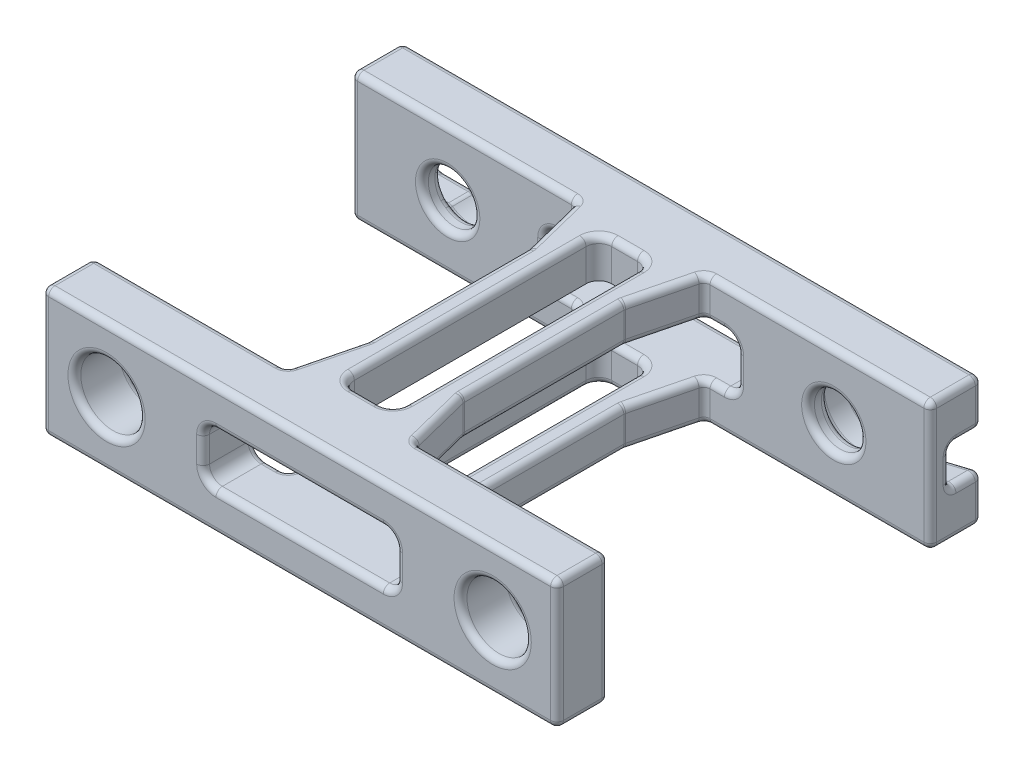
from build123d import *

# Parameters (mm, degrees)
SKETCH1_W               = 30
SKETCH1_H               = 20
SKETCH1_R               = 2
BOSS_EXTRUDE1_DEPTH     = 8
SKETCH2_R               = 2
CUT_EXTRUDE1_DEPTH      = 5
BOSS_EXTRUDE2_DEPTH     = 20
CUT_EXTRUDE2_DEPTH      = 20
CUT_EXTRUDE2_DEPTH_BACK = 62.717096497
SKETCH4_R               = 5
SKETCH5_R               = 4
SKETCH5_R_2             = 2
CUT_EXTRUDE3_DEPTH      = 65.311740763
FILLET4_R               = 1
FILLET5_R               = 1
SKETCH7_W               = 8
SKETCH7_H               = 24.753788748
CUT_EXTRUDE4_DEPTH      = 99.721831522
FILLET6_R               = 1
CUT_EXTRUDE5_DEPTH      = 98.190534669
CUT_EXTRUDE5_DEPTH_BACK = 98.190534669
FILLET7_R               = 1


with BuildPart() as part:
    # Sketch1 → Boss-Extrude1 (new body)
    with BuildSketch(Plane.XY):
        Rectangle(SKETCH1_W, SKETCH1_H)
        Circle(SKETCH1_R, mode=Mode.SUBTRACT)
    extrude(amount=BOSS_EXTRUDE1_DEPTH)

    # Sketch2 → Cut-Extrude1 (cut)
    with BuildSketch(Plane(origin=(0, 0, 0), x_dir=(-1, 0, 0), z_dir=(0, 0, -1))):
        with BuildLine():
            Line((-3.491060011, 4.25), (-8.491060011, 4.25))
            Line((-8.491060011, 4.25), (-15, 2.666622158))
            Line((-15, 2.666622158), (-15, -2.666622158))
            Line((-15, -2.666622158), (-8.491060011, -4.25))
            Line((-8.491060011, -4.25), (-3.491060011, -4.25))
            ThreePointArc((-3.491060011, -4.25), (5.5, 0), (-3.491060011, 4.25))
        make_face()
        Circle(SKETCH2_R, mode=Mode.SUBTRACT)
    extrude(amount=-CUT_EXTRUDE1_DEPTH, mode=Mode.SUBTRACT)

    # Sketch5 → Cut-Extrude3 (cut, through all)
    with BuildSketch(Plane(origin=(0, 0, 5), x_dir=(-1, 0, 0), z_dir=(0, 0, -1))):
        Circle(SKETCH5_R)
        Circle(SKETCH5_R_2, mode=Mode.SUBTRACT)
    extrude(amount=-CUT_EXTRUDE3_DEPTH, mode=Mode.SUBTRACT)


with BuildPart() as body_2:
    # Sketch3 → Boss-Extrude2 (new body)
    with BuildSketch(Plane(origin=(0, 10, 0), x_dir=(1, 0, 0), z_dir=(0, 1, 0))):
        Polygon((-30, -61), (10, -61), (10, -53), (-20, -53), (-22.5, -43), (-22.5, -18), (-20, -8), (-15, -8), (-15, 0), (-30, 0), align=None)
    extrude(amount=-BOSS_EXTRUDE2_DEPTH)

    # Sketch4 → Cut-Extrude2 (cut, two sides: drawn at the far end of the back side and taken through both)
    with BuildSketch(Plane(origin=(0, 0, 53), x_dir=(-1, 0, 0), z_dir=(0, 0, -1)).offset(-CUT_EXTRUDE2_DEPTH_BACK)):
        Circle(SKETCH4_R)
    extrude(amount=CUT_EXTRUDE2_DEPTH + CUT_EXTRUDE2_DEPTH_BACK, mode=Mode.SUBTRACT)


with BuildPart() as body_3:
    # Mirror4: mirrored copy
    add(body_2.part.mirror(Plane(origin=(-30, -10, 0), x_dir=(0, 0, 1), z_dir=(-1, 0, 0))))


with BuildPart() as body_4:
    # Mirror4 2: mirrored copy
    add(part.part.mirror(Plane(origin=(-30, -10, 0), x_dir=(0, 0, 1), z_dir=(-1, 0, 0))))


with BuildPart() as body_3_1:
    add(body_3.part)

    # Combine1: union body 2, body 4, part
    add(body_2.part)
    add(body_4.part)
    add(part.part)

    # Fillet4
    fillet4_edges = [body_3_1.edges().sort_by_distance(p)[0] for p in [
        (-37.5, -10, 30.5),
        (-55, 10, 53),
        (-70, 10, 57),
        (-30, 10, 61),
        (-30, 10, 0),
        (-38.75, -10, 13),
        (-57.5, 10, 8),
        (-38.75, 10, 13),
        (-37.5, 10, 30.5),
        (-38.75, 10, 48),
        (-57.5, -10, 8),
        (-40, 0, 53),
        (-70, 0, 53),
        (-70, 0, 61),
        (-40, 0, 8),
        (-37.5, 0, 18),
        (-37.5, 0, 43),
        (-30, -10, 0),
        (-30, -10, 61),
        (-38.75, -10, 48),
        (-70, -10, 57),
        (-55, -10, 53),
        (-21.25, 10, 48),
        (-22.5, 0, 43),
        (-5, 10, 53),
        (-20, 0, 53),
        (10, 10, 57),
        (10, 0, 53),
        (10, 0, 61),
        (11.745530005, 3.458311079, 0),
        (5.991060011, -4.25, 0),
        (-2.5, 10, 8),
        (15, 0, 8),
        (-21.25, -10, 13),
        (-20, 0, 8),
        (-22.5, -10, 30.5),
        (-22.5, 0, 18),
        (-21.25, -10, 48),
        (-5, -10, 53),
        (10, -10, 57),
        (-2.5, -10, 8),
        (-22.5, 10, 30.5),
        (-21.25, 10, 13),
        (15, 10, 4),
        (15, -6.333311079, 0),
        (15, 2.666622158, 2.5),
        (15, 6.333311079, 0),
        (15, -10, 4),
        (5.991060011, -4.25, 5),
        (8.491060011, -4.25, 2.5),
        (11.745530005, -3.458311079, 0),
        (15, -2.666622158, 2.5),
        (11.745530005, 3.458311079, 5),
        (8.491060011, 4.25, 2.5),
        (5.991060011, 4.25, 0),
        (3.491060011, 4.25, 2.5),
        (-5.5, 0, 0),
        (3.491060011, -4.25, 2.5),
        (-5.5, 0, 5),
        (5.991060011, 4.25, 5),
        (15, 0, 5),
        (11.745530005, -3.458311079, 5),
        (4, 0, 8),
        (-54.5, 0, 0),
        (-65.991060011, 4.25, 0),
        (-75, 6.333311079, 0),
        (-75, -6.333311079, 0),
        (-71.745530005, -3.458311079, 0),
        (-75, 0, 8),
        (-75, 10, 4),
        (-75, 0, 5),
        (-75, -2.666622158, 2.5),
        (-75, -10, 4),
        (-65.991060011, -4.25, 0),
        (-63.491060011, -4.25, 2.5),
        (-71.745530005, -3.458311079, 5),
        (-68.491060011, -4.25, 2.5),
        (-71.745530005, 3.458311079, 0),
        (-75, 2.666622158, 2.5),
        (-65.991060011, 4.25, 5),
        (-68.491060011, 4.25, 2.5),
        (-54.5, 0, 5),
        (-63.491060011, 4.25, 2.5),
        (-65.991060011, -4.25, 5),
        (-71.745530005, 3.458311079, 5),
    ]]
    fillet(fillet4_edges, radius=FILLET4_R)

    # Fillet5
    fillet5_edges = [body_3_1.edges().sort_by_distance(p)[0] for p in [
        (-4.5, 0, 5),
        (-55.5, 0, 5),
        (-65, 0, 61),
        (-65, 0, 53),
        (5, 0, 53),
        (5, 0, 61),
        (4, 0, 5),
        (-64, 0, 8),
        (-64, 0, 5),
    ]]
    fillet(fillet5_edges, radius=FILLET5_R)

    # Sketch7 → Cut-Extrude4 (cut, through all)
    with BuildSketch(Plane.XZ.offset(10)):
        with BuildLine():
            Line((-26, 12.5), (-26, 18.123105626))
            Line((-26, 18.123105626), (-34, 18.123105626))
            Line((-34, 18.123105626), (-34, 12.5))
            ThreePointArc((-34, 12.5), (-33.414213562, 11.085786438), (-32, 10.5))
            Line((-32, 10.5), (-28, 10.5))
            ThreePointArc((-28, 10.5), (-26.585786438, 11.085786438), (-26, 12.5))
        make_face()
        with Locations((-30, 30.5)):
            Rectangle(SKETCH7_W, SKETCH7_H)
        with BuildLine():
            Line((-34, 42.876894374), (-26, 42.876894374))
            Line((-26, 42.876894374), (-26, 48.5))
            ThreePointArc((-26, 48.5), (-26.585786438, 49.914213562), (-28, 50.5))
            Line((-28, 50.5), (-32, 50.5))
            ThreePointArc((-32, 50.5), (-33.414213562, 49.914213562), (-34, 48.5))
            Line((-34, 48.5), (-34, 42.876894374))
        make_face()
    extrude(amount=-CUT_EXTRUDE4_DEPTH, mode=Mode.SUBTRACT)

    # Fillet6
    fillet6_edges = [body_3_1.edges().sort_by_distance(p)[0] for p in [
        (-26.585786438, -10, 11.085786438),
        (-30, -10, 10.5),
        (-33.414213562, 10, 11.085786438),
        (-34, -10, 30.5),
        (-33.414213562, 10, 49.914213562),
        (-30, 10, 50.5),
        (-26.585786438, -10, 49.914213562),
        (-26, 10, 30.5),
        (-26.585786438, 10, 11.085786438),
        (-30, 10, 10.5),
        (-34, 10, 30.5),
        (-26.585786438, 10, 49.914213562),
        (-26, -10, 30.5),
        (-30, -10, 50.5),
        (-33.414213562, -10, 49.914213562),
        (-33.414213562, -10, 11.085786438),
    ]]
    fillet(fillet6_edges, radius=FILLET6_R)

    # Sketch8 → Cut-Extrude5 (cut, two sides: drawn at the far end of the back side and taken through both)
    with BuildSketch(Plane.XY.offset(61).offset(-CUT_EXTRUDE5_DEPTH_BACK)):
        with BuildLine():
            Line((-43, -4), (-17, -4))
            ThreePointArc((-17, -4), (-15.585786438, -3.414213562), (-15, -2))
            Line((-15, -2), (-15, 2))
            ThreePointArc((-15, 2), (-15.585786438, 3.414213562), (-17, 4))
            Line((-17, 4), (-43, 4))
            ThreePointArc((-43, 4), (-44.414213562, 3.414213562), (-45, 2))
            Line((-45, 2), (-45, -2))
            ThreePointArc((-45, -2), (-44.414213562, -3.414213562), (-43, -4))
        make_face()
    extrude(amount=CUT_EXTRUDE5_DEPTH + CUT_EXTRUDE5_DEPTH_BACK, mode=Mode.SUBTRACT)

    # Fillet7
    fillet7_edges = [body_3_1.edges().sort_by_distance(p)[0] for p in [
        (-26, -4, 30.5),
        (-15.585786438, -3.414213562, 8),
        (-15, 0, 8),
        (-15.585786438, 3.414213562, 8),
        (-44.414213562, -3.414213562, 8),
        (-45, 0, 8),
        (-44.414213562, 3.414213562, 8),
        (-44.414213562, -3.414213562, 61),
        (-45, 0, 61),
        (-44.414213562, 3.414213562, 61),
        (-15.585786438, 3.414213562, 53),
        (-15.585786438, 3.414213562, 0),
        (-15, 0, 53),
        (-15, 0, 0),
        (-15.585786438, -3.414213562, 61),
        (-30, 4, 61),
        (-22.5, 4, 30.5),
        (-21.329754297, 4, 13.319017188),
        (-38.670245703, 4, 13.319017188),
        (-37.5, 4, 30.5),
        (-18.109611797, 4, 8),
        (-19.834635803, 4, 8.211794562),
        (-22.492507557, 4, 18.000922362),
        (-22.492507557, 4, 42.999077638),
        (-21.329754297, 4, 47.680982812),
        (-19.834635803, 4, 52.788205438),
        (-18.109611797, 4, 53),
        (-41.890388203, -4, 53),
        (-40.165364197, -4, 52.788205438),
        (-38.670245703, -4, 47.680982812),
        (-37.507492443, -4, 42.999077638),
        (-37.507492443, -4, 18.000922362),
        (-40.165364197, -4, 8.211794562),
        (-41.890388203, -4, 8),
        (-30, -4, 0),
        (-18.109611797, -4, 8),
        (-19.834635803, -4, 8.211794562),
        (-22.492507557, -4, 18.000922362),
        (-22.492507557, -4, 42.999077638),
        (-21.329754297, -4, 47.680982812),
        (-19.834635803, -4, 52.788205438),
        (-18.109611797, -4, 53),
        (-33.414213562, -4, 11.085786438),
        (-33.414213562, -4, 49.914213562),
        (-30, -4, 50.5),
        (-22.5, -4, 30.5),
        (-21.329754297, -4, 13.319017188),
        (-30, -4, 10.5),
        (-26.585786438, -4, 11.085786438),
        (-26.585786438, -4, 49.914213562),
        (-34, -4, 30.5),
        (-44.414213562, -3.414213562, 53),
        (-45, 0, 53),
        (-44.414213562, 3.414213562, 53),
        (-40.165364197, 4, 8.211794562),
        (-41.890388203, 4, 8),
        (-41.890388203, 4, 53),
        (-40.165364197, 4, 52.788205438),
        (-38.670245703, 4, 47.680982812),
        (-37.507492443, 4, 42.999077638),
        (-37.507492443, 4, 18.000922362),
        (-15.585786438, -3.414213562, 53),
        (-38.670245703, -4, 13.319017188),
        (-37.5, -4, 30.5),
        (-44.414213562, -3.414213562, 0),
        (-45, 0, 0),
        (-44.414213562, 3.414213562, 0),
        (-30, 4, 0),
        (-15.585786438, -3.414213562, 0),
        (-30, -4, 61),
        (-15, 0, 61),
        (-15.585786438, 3.414213562, 61),
    ]]
    fillet(fillet7_edges, radius=FILLET7_R)


solid = body_3_1.part
